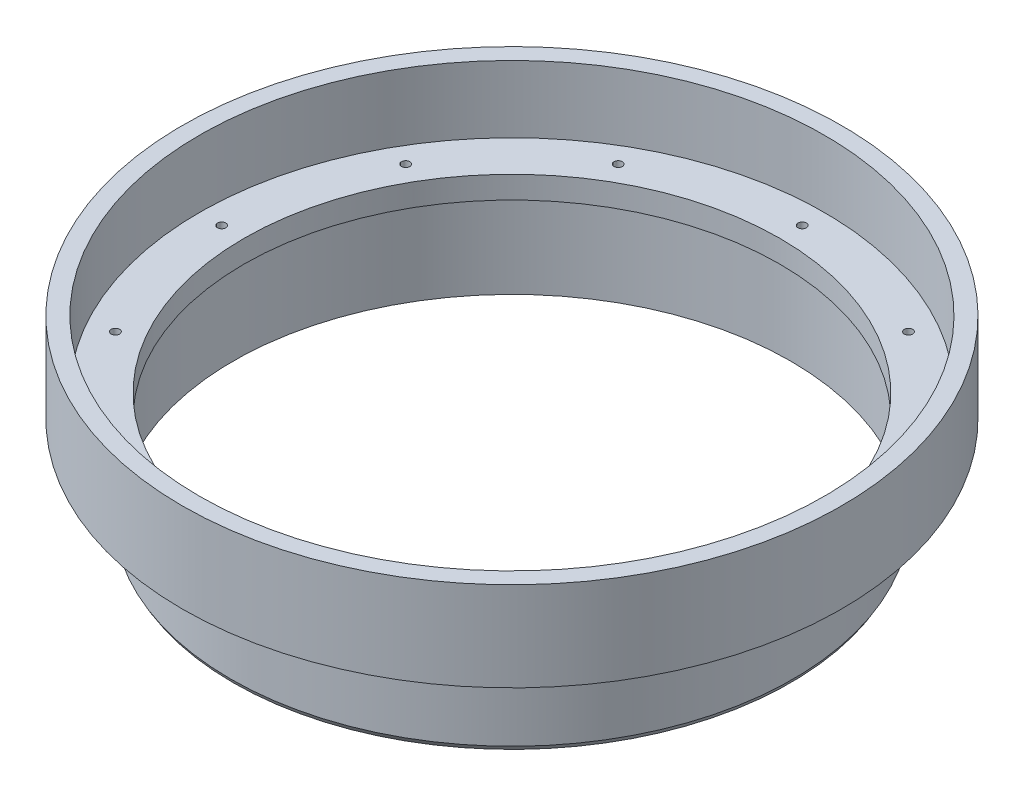
from build123d import *

# Parameters (mm, degrees)
SCREW_HOLES_COUNT = 12


with BuildPart() as part:
    # Cross Section → Main (revolve)
    with BuildSketch(Plane.XY):
        Polygon((-38.1, 0), (-38.1, -3.175), (-39.624, -3.175), (-39.624, -15.875), (-40.005, -15.215088642), (-40.005, -3.175), (-46.863, -3.175), (-46.863, 9.525), (-44.45, 9.525), (-44.45, 0), align=None)
    revolve(axis=Axis((0, 55, 0), (0, -1, 0)))

    # Sketch7 → #0-80 Tapped Hole1 (revolve, cut)
    with BuildSketch(Plane(origin=(-41.275, 0, 0), x_dir=(0, 0, 1), z_dir=(1, 0, 0))):
        Polygon((0, 0), (0, 3.532890611), (0.59563, 3.175), (0.59563, 0), align=None)
    f_0_80_tapped_hole1 = revolve(axis=Axis((-41.275, 6.35, 0), (0, -1, 0)), mode=Mode.SUBTRACT)

    # Screw Holes: #0-80 Tapped Hole1 ×12 about axis
    screw_holes_axis = Axis((0, 55, 0), (0, -1, 0))
    for i in range(1, SCREW_HOLES_COUNT):
        add(f_0_80_tapped_hole1.rotate(screw_holes_axis, i * 360 / SCREW_HOLES_COUNT), mode=Mode.SUBTRACT)


solid = part.part
